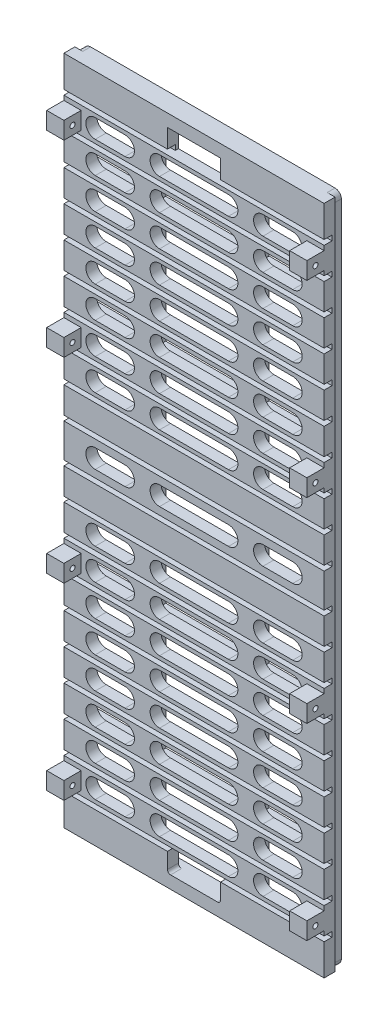
from build123d import *

# Parameters (mm, degrees)
SKETCH1_W                 = 83
SKETCH1_H                 = 214
BOSS_EXTRUDE1_DEPTH       = 8.4
SKETCH2_W                 = 77
SKETCH2_H                 = 4.9
CUT_EXTRUDE1_DEPTH        = 219.148596145
SKETCH3_W                 = 7.4
SKETCH3_H                 = 1.6
CUT_EXTRUDE2_DEPTH        = 136.678148572
LPATTERN1_COUNT           = 10
LPATTERN1_PITCH           = 10
MIRROR8_COPY_1_SKETCH_W   = 7.4
MIRROR8_COPY_1_SKETCH_H   = 1.6
MIRROR8_COPY_1_DEPTH      = 136.678148572
MIRROR8_COPY_2_SKETCH_W   = 7.4
MIRROR8_COPY_2_SKETCH_H   = 1.6
MIRROR8_COPY_2_DEPTH      = 136.678148572
MIRROR8_COPY_3_SKETCH_W   = 7.4
MIRROR8_COPY_3_SKETCH_H   = 1.6
MIRROR8_COPY_3_DEPTH      = 136.678148572
MIRROR8_COPY_4_SKETCH_W   = 7.4
MIRROR8_COPY_4_SKETCH_H   = 1.6
MIRROR8_COPY_4_DEPTH      = 136.678148572
MIRROR8_COPY_5_SKETCH_W   = 7.4
MIRROR8_COPY_5_SKETCH_H   = 1.6
MIRROR8_COPY_5_DEPTH      = 136.678148572
MIRROR8_COPY_6_SKETCH_W   = 7.4
MIRROR8_COPY_6_SKETCH_H   = 1.6
MIRROR8_COPY_6_DEPTH      = 136.678148572
MIRROR8_COPY_7_SKETCH_W   = 7.4
MIRROR8_COPY_7_SKETCH_H   = 1.6
MIRROR8_COPY_7_DEPTH      = 136.678148572
MIRROR8_COPY_8_SKETCH_W   = 7.4
MIRROR8_COPY_8_SKETCH_H   = 1.6
MIRROR8_COPY_8_DEPTH      = 136.678148572
MIRROR8_COPY_9_SKETCH_W   = 7.4
MIRROR8_COPY_9_SKETCH_H   = 1.6
MIRROR8_COPY_9_DEPTH      = 136.678148572
CUT_EXTRUDE6_DEPTH        = 115.870622876
LPATTERN3_COUNT           = 8
LPATTERN3_PITCH           = 10
MIRROR1_COPY_1_DEPTH      = 115.870622876
MIRROR1_COPY_2_DEPTH      = 115.870622876
MIRROR1_COPY_3_DEPTH      = 115.870622876
MIRROR1_COPY_4_DEPTH      = 115.870622876
MIRROR1_COPY_5_DEPTH      = 115.870622876
MIRROR1_COPY_6_DEPTH      = 115.870622876
MIRROR1_COPY_7_DEPTH      = 115.870622876
CUT_EXTRUDE7_DEPTH        = 115.870622876
SOLARBEZEL_DEPTH          = 2.5
M2X0_4_TAPPED_HOLE2_D     = 1.6
M2X0_4_TAPPED_HOLE2_DEPTH = 5.2
M2X0_4_TAPPED_HOLE2_TIP   = 0.480688495
SKETCH25_W                = 74
SKETCH25_H                = 3
BOSS_EXTRUDE4_DEPTH       = 2.5
SKETCH26_W                = 3
SKETCH26_H                = 206
BOSS_EXTRUDE5_DEPTH       = 2.5
SKETCH19_W                = 10.467012774
SKETCH19_H                = 5.847911184
REMOVEOLDPILLARS_DEPTH    = 219.148596145
SKETCH5_W                 = 5.5
SKETCH5_H                 = 5.5
BOSS_EXTRUDE3_DEPTH       = 5.5
M2X0_4_TAPPED_HOLE5_D     = 1.6
LPATTERN2_COUNT           = 2
LPATTERN2_PITCH           = 60
MIRROR2_COPY_1_SKETCH_W   = 5.5
MIRROR2_COPY_1_SKETCH_H   = 5.5
MIRROR2_COPY_1_DEPTH      = 5.5
MIRROR2_COPY_2_D          = 1.6
MIRROR6_COPY_1_SKETCH_W   = 5.5
MIRROR6_COPY_1_SKETCH_H   = 5.5
MIRROR6_COPY_1_DEPTH      = 5.5
MIRROR6_COPY_2_D          = 1.6
MIRROR6_COPY_3_SKETCH_W   = 5.5
MIRROR6_COPY_3_SKETCH_H   = 5.5
MIRROR6_COPY_3_DEPTH      = 5.5
MIRROR6_COPY_4_D          = 1.6
MIRROR6_COPY_5_SKETCH_W   = 5.5
MIRROR6_COPY_5_SKETCH_H   = 5.5
MIRROR6_COPY_5_DEPTH      = 5.5
MIRROR6_COPY_6_D          = 1.6
CUT_EXTRUDE3_DEPTH        = 116.118417293
SKETCH30_W                = 16.95
SKETCH30_H                = 7.6
CUT_EXTRUDE8_DEPTH        = 10


with BuildPart() as part:
    # Sketch1 → Boss-Extrude1 (new body)
    with BuildSketch(Plane.XY):
        Rectangle(SKETCH1_W, SKETCH1_H)
    extrude(amount=BOSS_EXTRUDE1_DEPTH)

    # Sketch2 → Cut-Extrude1 (cut, through all)
    with BuildSketch(Plane(origin=(0, 107, 0), x_dir=(1, 0, 0), z_dir=(0, 1, 0))):
        with Locations((-3, -5.95)):
            Rectangle(SKETCH2_W, SKETCH2_H)
    extrude(amount=-CUT_EXTRUDE1_DEPTH, mode=Mode.SUBTRACT)

    # Sketch3 → Cut-Extrude2 (cut, through all)
    with BuildSketch(Plane(origin=(41.5, 0, 0), x_dir=(0, 0, -1), z_dir=(1, 0, 0))):
        with Locations((-4.7, 96.2)):
            Rectangle(SKETCH3_W, SKETCH3_H)
    cut_extrude2 = extrude(amount=-CUT_EXTRUDE2_DEPTH, mode=Mode.SUBTRACT)

    # LPattern1: Cut-Extrude2 ×10
    with Locations(*[(0, -i * LPATTERN1_PITCH, 0) for i in range(1, LPATTERN1_COUNT)]):
        add(cut_extrude2, mode=Mode.SUBTRACT)

    # Mirror8: Cut-Extrude2 across plane
    add(cut_extrude2.mirror(Plane.ZX), mode=Mode.SUBTRACT)

    # Mirror8 copy 1 sketch → Mirror8 copy 1 (cut, through all)
    with BuildSketch(Plane(origin=(41.5, 10, 0), x_dir=(0, 0, -1), z_dir=(1, 0, 0))):
        with Locations((-4.7, -96.2)):
            Rectangle(MIRROR8_COPY_1_SKETCH_W, MIRROR8_COPY_1_SKETCH_H)
    extrude(amount=-MIRROR8_COPY_1_DEPTH, mode=Mode.SUBTRACT)

    # Mirror8 copy 2 sketch → Mirror8 copy 2 (cut, through all)
    with BuildSketch(Plane(origin=(41.5, 20, 0), x_dir=(0, 0, -1), z_dir=(1, 0, 0))):
        with Locations((-4.7, -96.2)):
            Rectangle(MIRROR8_COPY_2_SKETCH_W, MIRROR8_COPY_2_SKETCH_H)
    extrude(amount=-MIRROR8_COPY_2_DEPTH, mode=Mode.SUBTRACT)

    # Mirror8 copy 3 sketch → Mirror8 copy 3 (cut, through all)
    with BuildSketch(Plane(origin=(41.5, 30, 0), x_dir=(0, 0, -1), z_dir=(1, 0, 0))):
        with Locations((-4.7, -96.2)):
            Rectangle(MIRROR8_COPY_3_SKETCH_W, MIRROR8_COPY_3_SKETCH_H)
    extrude(amount=-MIRROR8_COPY_3_DEPTH, mode=Mode.SUBTRACT)

    # Mirror8 copy 4 sketch → Mirror8 copy 4 (cut, through all)
    with BuildSketch(Plane(origin=(41.5, 40, 0), x_dir=(0, 0, -1), z_dir=(1, 0, 0))):
        with Locations((-4.7, -96.2)):
            Rectangle(MIRROR8_COPY_4_SKETCH_W, MIRROR8_COPY_4_SKETCH_H)
    extrude(amount=-MIRROR8_COPY_4_DEPTH, mode=Mode.SUBTRACT)

    # Mirror8 copy 5 sketch → Mirror8 copy 5 (cut, through all)
    with BuildSketch(Plane(origin=(41.5, 50, 0), x_dir=(0, 0, -1), z_dir=(1, 0, 0))):
        with Locations((-4.7, -96.2)):
            Rectangle(MIRROR8_COPY_5_SKETCH_W, MIRROR8_COPY_5_SKETCH_H)
    extrude(amount=-MIRROR8_COPY_5_DEPTH, mode=Mode.SUBTRACT)

    # Mirror8 copy 6 sketch → Mirror8 copy 6 (cut, through all)
    with BuildSketch(Plane(origin=(41.5, 60, 0), x_dir=(0, 0, -1), z_dir=(1, 0, 0))):
        with Locations((-4.7, -96.2)):
            Rectangle(MIRROR8_COPY_6_SKETCH_W, MIRROR8_COPY_6_SKETCH_H)
    extrude(amount=-MIRROR8_COPY_6_DEPTH, mode=Mode.SUBTRACT)

    # Mirror8 copy 7 sketch → Mirror8 copy 7 (cut, through all)
    with BuildSketch(Plane(origin=(41.5, 70, 0), x_dir=(0, 0, -1), z_dir=(1, 0, 0))):
        with Locations((-4.7, -96.2)):
            Rectangle(MIRROR8_COPY_7_SKETCH_W, MIRROR8_COPY_7_SKETCH_H)
    extrude(amount=-MIRROR8_COPY_7_DEPTH, mode=Mode.SUBTRACT)

    # Mirror8 copy 8 sketch → Mirror8 copy 8 (cut, through all)
    with BuildSketch(Plane(origin=(41.5, 80, 0), x_dir=(0, 0, -1), z_dir=(1, 0, 0))):
        with Locations((-4.7, -96.2)):
            Rectangle(MIRROR8_COPY_8_SKETCH_W, MIRROR8_COPY_8_SKETCH_H)
    extrude(amount=-MIRROR8_COPY_8_DEPTH, mode=Mode.SUBTRACT)

    # Mirror8 copy 9 sketch → Mirror8 copy 9 (cut, through all)
    with BuildSketch(Plane(origin=(41.5, 90, 0), x_dir=(0, 0, -1), z_dir=(1, 0, 0))):
        with Locations((-4.7, -96.2)):
            Rectangle(MIRROR8_COPY_9_SKETCH_W, MIRROR8_COPY_9_SKETCH_H)
    extrude(amount=-MIRROR8_COPY_9_DEPTH, mode=Mode.SUBTRACT)

    # Sketch22 → Cut-Extrude6 (cut, through all)
    with BuildSketch(Plane.XY.offset(3.5)):
        with BuildLine():
            Line((-31.5, 94.2), (-22, 94.2))
            ThreePointArc((-22, 94.2), (-19, 91.2), (-22, 88.2))
            Line((-22, 88.2), (-31.5, 88.2))
            ThreePointArc((-31.5, 88.2), (-34.5, 91.2), (-31.5, 94.2))
        make_face()
        with BuildLine():
            Line((31.5, 94.2), (22, 94.2))
            ThreePointArc((22, 94.2), (19, 91.2), (22, 88.2))
            Line((22, 88.2), (31.5, 88.2))
            ThreePointArc((31.5, 88.2), (34.5, 91.2), (31.5, 94.2))
        make_face()
        with BuildLine():
            Line((-11, 94.2), (11, 94.2))
            ThreePointArc((11, 94.2), (14, 91.2), (11, 88.2))
            Line((11, 88.2), (-11, 88.2))
            ThreePointArc((-11, 88.2), (-14, 91.2), (-11, 94.2))
        make_face()
    cut_extrude6 = extrude(amount=-CUT_EXTRUDE6_DEPTH, mode=Mode.SUBTRACT)

    # LPattern3: Cut-Extrude6 ×8
    with Locations(*[(0, -i * LPATTERN3_PITCH, 0) for i in range(1, LPATTERN3_COUNT)]):
        add(cut_extrude6, mode=Mode.SUBTRACT)

    # Mirror1: Cut-Extrude6 across plane
    add(cut_extrude6.mirror(Plane.ZX), mode=Mode.SUBTRACT)

    # Mirror1 copy 1 sketch → Mirror1 copy 1 (cut, through all)
    with BuildSketch(Plane(origin=(0, 10, 3.5), x_dir=(1, 0, 0), z_dir=(0, 0, 1))):
        with BuildLine():
            Line((-31.5, -94.2), (-22, -94.2))
            ThreePointArc((-22, -94.2), (-19, -91.2), (-22, -88.2))
            Line((-22, -88.2), (-31.5, -88.2))
            ThreePointArc((-31.5, -88.2), (-34.5, -91.2), (-31.5, -94.2))
        make_face()
        with BuildLine():
            Line((31.5, -94.2), (22, -94.2))
            ThreePointArc((22, -94.2), (19, -91.2), (22, -88.2))
            Line((22, -88.2), (31.5, -88.2))
            ThreePointArc((31.5, -88.2), (34.5, -91.2), (31.5, -94.2))
        make_face()
        with BuildLine():
            Line((-11, -94.2), (11, -94.2))
            ThreePointArc((11, -94.2), (14, -91.2), (11, -88.2))
            Line((11, -88.2), (-11, -88.2))
            ThreePointArc((-11, -88.2), (-14, -91.2), (-11, -94.2))
        make_face()
    extrude(amount=-MIRROR1_COPY_1_DEPTH, mode=Mode.SUBTRACT)

    # Mirror1 copy 2 sketch → Mirror1 copy 2 (cut, through all)
    with BuildSketch(Plane(origin=(0, 20, 3.5), x_dir=(1, 0, 0), z_dir=(0, 0, 1))):
        with BuildLine():
            Line((-31.5, -94.2), (-22, -94.2))
            ThreePointArc((-22, -94.2), (-19, -91.2), (-22, -88.2))
            Line((-22, -88.2), (-31.5, -88.2))
            ThreePointArc((-31.5, -88.2), (-34.5, -91.2), (-31.5, -94.2))
        make_face()
        with BuildLine():
            Line((31.5, -94.2), (22, -94.2))
            ThreePointArc((22, -94.2), (19, -91.2), (22, -88.2))
            Line((22, -88.2), (31.5, -88.2))
            ThreePointArc((31.5, -88.2), (34.5, -91.2), (31.5, -94.2))
        make_face()
        with BuildLine():
            Line((-11, -94.2), (11, -94.2))
            ThreePointArc((11, -94.2), (14, -91.2), (11, -88.2))
            Line((11, -88.2), (-11, -88.2))
            ThreePointArc((-11, -88.2), (-14, -91.2), (-11, -94.2))
        make_face()
    extrude(amount=-MIRROR1_COPY_2_DEPTH, mode=Mode.SUBTRACT)

    # Mirror1 copy 3 sketch → Mirror1 copy 3 (cut, through all)
    with BuildSketch(Plane(origin=(0, 30, 3.5), x_dir=(1, 0, 0), z_dir=(0, 0, 1))):
        with BuildLine():
            Line((-31.5, -94.2), (-22, -94.2))
            ThreePointArc((-22, -94.2), (-19, -91.2), (-22, -88.2))
            Line((-22, -88.2), (-31.5, -88.2))
            ThreePointArc((-31.5, -88.2), (-34.5, -91.2), (-31.5, -94.2))
        make_face()
        with BuildLine():
            Line((31.5, -94.2), (22, -94.2))
            ThreePointArc((22, -94.2), (19, -91.2), (22, -88.2))
            Line((22, -88.2), (31.5, -88.2))
            ThreePointArc((31.5, -88.2), (34.5, -91.2), (31.5, -94.2))
        make_face()
        with BuildLine():
            Line((-11, -94.2), (11, -94.2))
            ThreePointArc((11, -94.2), (14, -91.2), (11, -88.2))
            Line((11, -88.2), (-11, -88.2))
            ThreePointArc((-11, -88.2), (-14, -91.2), (-11, -94.2))
        make_face()
    extrude(amount=-MIRROR1_COPY_3_DEPTH, mode=Mode.SUBTRACT)

    # Mirror1 copy 4 sketch → Mirror1 copy 4 (cut, through all)
    with BuildSketch(Plane(origin=(0, 40, 3.5), x_dir=(1, 0, 0), z_dir=(0, 0, 1))):
        with BuildLine():
            Line((-31.5, -94.2), (-22, -94.2))
            ThreePointArc((-22, -94.2), (-19, -91.2), (-22, -88.2))
            Line((-22, -88.2), (-31.5, -88.2))
            ThreePointArc((-31.5, -88.2), (-34.5, -91.2), (-31.5, -94.2))
        make_face()
        with BuildLine():
            Line((31.5, -94.2), (22, -94.2))
            ThreePointArc((22, -94.2), (19, -91.2), (22, -88.2))
            Line((22, -88.2), (31.5, -88.2))
            ThreePointArc((31.5, -88.2), (34.5, -91.2), (31.5, -94.2))
        make_face()
        with BuildLine():
            Line((-11, -94.2), (11, -94.2))
            ThreePointArc((11, -94.2), (14, -91.2), (11, -88.2))
            Line((11, -88.2), (-11, -88.2))
            ThreePointArc((-11, -88.2), (-14, -91.2), (-11, -94.2))
        make_face()
    extrude(amount=-MIRROR1_COPY_4_DEPTH, mode=Mode.SUBTRACT)

    # Mirror1 copy 5 sketch → Mirror1 copy 5 (cut, through all)
    with BuildSketch(Plane(origin=(0, 50, 3.5), x_dir=(1, 0, 0), z_dir=(0, 0, 1))):
        with BuildLine():
            Line((-31.5, -94.2), (-22, -94.2))
            ThreePointArc((-22, -94.2), (-19, -91.2), (-22, -88.2))
            Line((-22, -88.2), (-31.5, -88.2))
            ThreePointArc((-31.5, -88.2), (-34.5, -91.2), (-31.5, -94.2))
        make_face()
        with BuildLine():
            Line((31.5, -94.2), (22, -94.2))
            ThreePointArc((22, -94.2), (19, -91.2), (22, -88.2))
            Line((22, -88.2), (31.5, -88.2))
            ThreePointArc((31.5, -88.2), (34.5, -91.2), (31.5, -94.2))
        make_face()
        with BuildLine():
            Line((-11, -94.2), (11, -94.2))
            ThreePointArc((11, -94.2), (14, -91.2), (11, -88.2))
            Line((11, -88.2), (-11, -88.2))
            ThreePointArc((-11, -88.2), (-14, -91.2), (-11, -94.2))
        make_face()
    extrude(amount=-MIRROR1_COPY_5_DEPTH, mode=Mode.SUBTRACT)

    # Mirror1 copy 6 sketch → Mirror1 copy 6 (cut, through all)
    with BuildSketch(Plane(origin=(0, 60, 3.5), x_dir=(1, 0, 0), z_dir=(0, 0, 1))):
        with BuildLine():
            Line((-31.5, -94.2), (-22, -94.2))
            ThreePointArc((-22, -94.2), (-19, -91.2), (-22, -88.2))
            Line((-22, -88.2), (-31.5, -88.2))
            ThreePointArc((-31.5, -88.2), (-34.5, -91.2), (-31.5, -94.2))
        make_face()
        with BuildLine():
            Line((31.5, -94.2), (22, -94.2))
            ThreePointArc((22, -94.2), (19, -91.2), (22, -88.2))
            Line((22, -88.2), (31.5, -88.2))
            ThreePointArc((31.5, -88.2), (34.5, -91.2), (31.5, -94.2))
        make_face()
        with BuildLine():
            Line((-11, -94.2), (11, -94.2))
            ThreePointArc((11, -94.2), (14, -91.2), (11, -88.2))
            Line((11, -88.2), (-11, -88.2))
            ThreePointArc((-11, -88.2), (-14, -91.2), (-11, -94.2))
        make_face()
    extrude(amount=-MIRROR1_COPY_6_DEPTH, mode=Mode.SUBTRACT)

    # Mirror1 copy 7 sketch → Mirror1 copy 7 (cut, through all)
    with BuildSketch(Plane(origin=(0, 70, 3.5), x_dir=(1, 0, 0), z_dir=(0, 0, 1))):
        with BuildLine():
            Line((-31.5, -94.2), (-22, -94.2))
            ThreePointArc((-22, -94.2), (-19, -91.2), (-22, -88.2))
            Line((-22, -88.2), (-31.5, -88.2))
            ThreePointArc((-31.5, -88.2), (-34.5, -91.2), (-31.5, -94.2))
        make_face()
        with BuildLine():
            Line((31.5, -94.2), (22, -94.2))
            ThreePointArc((22, -94.2), (19, -91.2), (22, -88.2))
            Line((22, -88.2), (31.5, -88.2))
            ThreePointArc((31.5, -88.2), (34.5, -91.2), (31.5, -94.2))
        make_face()
        with BuildLine():
            Line((-11, -94.2), (11, -94.2))
            ThreePointArc((11, -94.2), (14, -91.2), (11, -88.2))
            Line((11, -88.2), (-11, -88.2))
            ThreePointArc((-11, -88.2), (-14, -91.2), (-11, -94.2))
        make_face()
    extrude(amount=-MIRROR1_COPY_7_DEPTH, mode=Mode.SUBTRACT)

    # Sketch23 → Cut-Extrude7 (cut, through all)
    with BuildSketch(Plane.XY.offset(3.5)):
        with BuildLine():
            Line((31.5, 3), (22, 3))
            ThreePointArc((22, 3), (19, 0), (22, -3))
            Line((22, -3), (31.5, -3))
            ThreePointArc((31.5, -3), (34.5, 0), (31.5, 3))
        make_face()
        with BuildLine():
            Line((11, 3), (-11, 3))
            ThreePointArc((-11, 3), (-14, 0), (-11, -3))
            Line((-11, -3), (11, -3))
            ThreePointArc((11, -3), (14, 0), (11, 3))
        make_face()
        with BuildLine():
            Line((-22, 3), (-31.5, 3))
            ThreePointArc((-31.5, 3), (-34.5, 0), (-31.5, -3))
            Line((-31.5, -3), (-22, -3))
            ThreePointArc((-22, -3), (-19, 0), (-22, 3))
        make_face()
    extrude(amount=-CUT_EXTRUDE7_DEPTH, mode=Mode.SUBTRACT)

    # Sketch4 → solarBezel (add)
    with BuildSketch(Plane(origin=(0, 0, 0), x_dir=(-1, 0, 0), z_dir=(0, 0, -1))):
        with BuildLine():
            Line((-39, 107), (39, 107))
            ThreePointArc((39, 107), (40.414213562, 106.414213562), (41, 105))
            Line((41, 105), (41, -105))
            ThreePointArc((41, -105), (40.414213562, -106.414213562), (39, -107))
            Line((39, -107), (-39, -107))
            ThreePointArc((-39, -107), (-40.414213562, -106.414213562), (-41, -105))
            Line((-41, -105), (-41, 105))
            ThreePointArc((-41, 105), (-40.414213562, 106.414213562), (-39, 107))
        make_face()
        with BuildLine():
            Line((-35, -103), (35, -103))
            ThreePointArc((35, -103), (36.414213562, -102.414213562), (37, -101))
            Line((37, -101), (37, 101))
            ThreePointArc((37, 101), (36.414213562, 102.414213562), (35, 103))
            Line((35, 103), (-35, 103))
            ThreePointArc((-35, 103), (-36.414213562, 102.414213562), (-37, 101))
            Line((-37, 101), (-37, -101))
            ThreePointArc((-37, -101), (-36.414213562, -102.414213562), (-35, -103))
        make_face(mode=Mode.SUBTRACT)
    extrude(amount=SOLARBEZEL_DEPTH)

    # M2x0.4 Tapped Hole2
    with Locations(Plane(origin=(0, 0, -2.5), x_dir=(-1, 0, 0), z_dir=(0, 0, -1))):
        with Locations((-39, 102), (39, 102), (39, 72), (39, 42), (39, 12), (-39, 72), (-39, 42), (-39, 12), (39, -102), (-39, -12), (-39, -42), (-39, -72), (39, -12), (39, -42), (39, -72), (-39, -102)):
            Hole(M2X0_4_TAPPED_HOLE2_D / 2, depth=M2X0_4_TAPPED_HOLE2_DEPTH)
            with Locations((0, 0, -(M2X0_4_TAPPED_HOLE2_DEPTH + M2X0_4_TAPPED_HOLE2_TIP / 2))):  # 118° drill point
                Cone(0, M2X0_4_TAPPED_HOLE2_D / 2, M2X0_4_TAPPED_HOLE2_TIP, mode=Mode.SUBTRACT)

    # Sketch25 → Boss-Extrude4 (add)
    with BuildSketch(Plane(origin=(0, 0, -2.5), x_dir=(-1, 0, 0), z_dir=(0, 0, -1))):
        with Locations((0, 76.2)):
            Rectangle(SKETCH25_W, SKETCH25_H)
        with Locations((0, 36.2)):
            Rectangle(SKETCH25_W, SKETCH25_H)
        with Locations((0, 8.5)):
            Rectangle(SKETCH25_W, SKETCH25_H)
        with Locations((0, -76.2)):
            Rectangle(SKETCH25_W, SKETCH25_H)
        with Locations((0, -36.2)):
            Rectangle(SKETCH25_W, SKETCH25_H)
        with Locations((0, -8.5)):
            Rectangle(SKETCH25_W, SKETCH25_H)
    extrude(amount=-BOSS_EXTRUDE4_DEPTH)

    # Sketch26 → Boss-Extrude5 (add)
    with BuildSketch(Plane(origin=(0, 0, -2.5), x_dir=(-1, 0, 0), z_dir=(0, 0, -1))):
        with Locations((-16.5, 0)):
            Rectangle(SKETCH26_W, SKETCH26_H)
        with Locations((16.5, 0)):
            Rectangle(SKETCH26_W, SKETCH26_H)
    extrude(amount=-BOSS_EXTRUDE5_DEPTH)

    # Sketch19 → removeOldPillars (cut, through all)
    with BuildSketch(Plane.XZ.offset(107)):
        with Locations((40.733506387, 6.423955592)):
            Rectangle(SKETCH19_W, SKETCH19_H)
    extrude(amount=-REMOVEOLDPILLARS_DEPTH, mode=Mode.SUBTRACT)

    # Sketch5 → Boss-Extrude3 (add)
    with BuildSketch(Plane.XY.offset(3.5)):
        with Locations((-38.75, 91.2)):
            Rectangle(SKETCH5_W, SKETCH5_H)
    boss_extrude3 = extrude(amount=BOSS_EXTRUDE3_DEPTH)

    # M2x0.4 Tapped Hole5 (through all)
    with Locations(Plane.ZY.offset(41.5)):
        with Locations((6.25, 91.2)):
            m2x0_4_tapped_hole5 = Hole(M2X0_4_TAPPED_HOLE5_D / 2)

    # LPattern2: Boss-Extrude3, M2x0.4 Tapped Hole5 ×2
    with Locations(*[(0, -i * LPATTERN2_PITCH, 0) for i in range(1, LPATTERN2_COUNT)]):
        add(boss_extrude3)
        add(m2x0_4_tapped_hole5, mode=Mode.SUBTRACT)

    # Mirror2: Boss-Extrude3, M2x0.4 Tapped Hole5 across plane
    add(boss_extrude3.mirror(Plane.ZX))
    add(m2x0_4_tapped_hole5.mirror(Plane.ZX), mode=Mode.SUBTRACT)

    # Mirror2 copy 1 sketch → Mirror2 copy 1 (add)
    with BuildSketch(Plane(origin=(0, 60, 3.5), x_dir=(1, 0, 0), z_dir=(0, 0, 1))):
        with Locations((-38.75, -91.2)):
            Rectangle(MIRROR2_COPY_1_SKETCH_W, MIRROR2_COPY_1_SKETCH_H)
    extrude(amount=MIRROR2_COPY_1_DEPTH)

    # Mirror2 copy 2 (through all)
    with Locations(Plane(origin=(-41.5, 60, 0), x_dir=(0, 0, 1), z_dir=(-1, 0, 0))):
        with Locations((6.25, -91.2)):
            Hole(MIRROR2_COPY_2_D / 2)

    # Mirror6: Boss-Extrude3, M2x0.4 Tapped Hole5 across plane
    add(boss_extrude3.mirror(Plane(origin=(0, 0, 0), x_dir=(0, 0, 1), z_dir=(1, 0, 0))))
    add(m2x0_4_tapped_hole5.mirror(Plane(origin=(0, 0, 0), x_dir=(0, 0, 1), z_dir=(1, 0, 0))), mode=Mode.SUBTRACT)

    # Mirror6 copy 1 sketch → Mirror6 copy 1 (add)
    with BuildSketch(Plane(origin=(0, -60, 3.5), x_dir=(-1, 0, 0), z_dir=(0, 0, 1))):
        with Locations((-38.75, -91.2)):
            Rectangle(MIRROR6_COPY_1_SKETCH_W, MIRROR6_COPY_1_SKETCH_H)
    extrude(amount=MIRROR6_COPY_1_DEPTH)

    # Mirror6 copy 2 (through all)
    with Locations(Plane(origin=(41.5, -60, 0), x_dir=(0, 0, 1), z_dir=(1, 0, 0))):
        with Locations((6.25, -91.2)):
            Hole(MIRROR6_COPY_2_D / 2)

    # Mirror6 copy 3 sketch → Mirror6 copy 3 (add)
    with BuildSketch(Plane(origin=(0, 0, 3.5), x_dir=(-1, 0, 0), z_dir=(0, 0, 1))):
        with Locations((-38.75, 91.2)):
            Rectangle(MIRROR6_COPY_3_SKETCH_W, MIRROR6_COPY_3_SKETCH_H)
    extrude(amount=MIRROR6_COPY_3_DEPTH)

    # Mirror6 copy 4 (through all)
    with Locations(Plane(origin=(41.5, 0, 0), x_dir=(0, 0, 1), z_dir=(1, 0, 0))):
        with Locations((6.25, 91.2)):
            Hole(MIRROR6_COPY_4_D / 2)

    # Mirror6 copy 5 sketch → Mirror6 copy 5 (add)
    with BuildSketch(Plane(origin=(0, 60, 3.5), x_dir=(-1, 0, 0), z_dir=(0, 0, 1))):
        with Locations((-38.75, 91.2)):
            Rectangle(MIRROR6_COPY_5_SKETCH_W, MIRROR6_COPY_5_SKETCH_H)
    extrude(amount=MIRROR6_COPY_5_DEPTH)

    # Mirror6 copy 6 (through all)
    with Locations(Plane(origin=(41.5, 60, 0), x_dir=(0, 0, 1), z_dir=(1, 0, 0))):
        with Locations((6.25, 91.2)):
            Hole(MIRROR6_COPY_6_D / 2)

    # Sketch6 → Cut-Extrude3 (cut, through all)
    with BuildSketch(Plane(origin=(0, 0, 0), x_dir=(-1, 0, 0), z_dir=(0, 0, -1))):
        with BuildLine():
            Line((-7.475, 95.4), (7.475, 95.4))
            ThreePointArc((7.475, 95.4), (8.182106781, 95.692893219), (8.475, 96.4))
            Line((8.475, 96.4), (8.475, 102))
            ThreePointArc((8.475, 102), (8.182106781, 102.707106781), (7.475, 103))
            Line((7.475, 103), (-7.475, 103))
            ThreePointArc((-7.475, 103), (-8.182106781, 102.707106781), (-8.475, 102))
            Line((-8.475, 102), (-8.475, 96.4))
            ThreePointArc((-8.475, 96.4), (-8.182106781, 95.692893219), (-7.475, 95.4))
        make_face()
    cut_extrude3 = extrude(amount=-CUT_EXTRUDE3_DEPTH, mode=Mode.SUBTRACT)

    # Mirror3: Cut-Extrude3 across plane
    add(cut_extrude3.mirror(Plane.ZX), mode=Mode.SUBTRACT)

    # Sketch30 → Cut-Extrude8 (cut)
    with BuildSketch(Plane(origin=(0, 0, 0), x_dir=(-1, 0, 0), z_dir=(0, 0, -1))):
        with Locations((0, 99.2)):
            Rectangle(SKETCH30_W, SKETCH30_H)
    extrude(amount=-CUT_EXTRUDE8_DEPTH, mode=Mode.SUBTRACT)


solid = part.part
